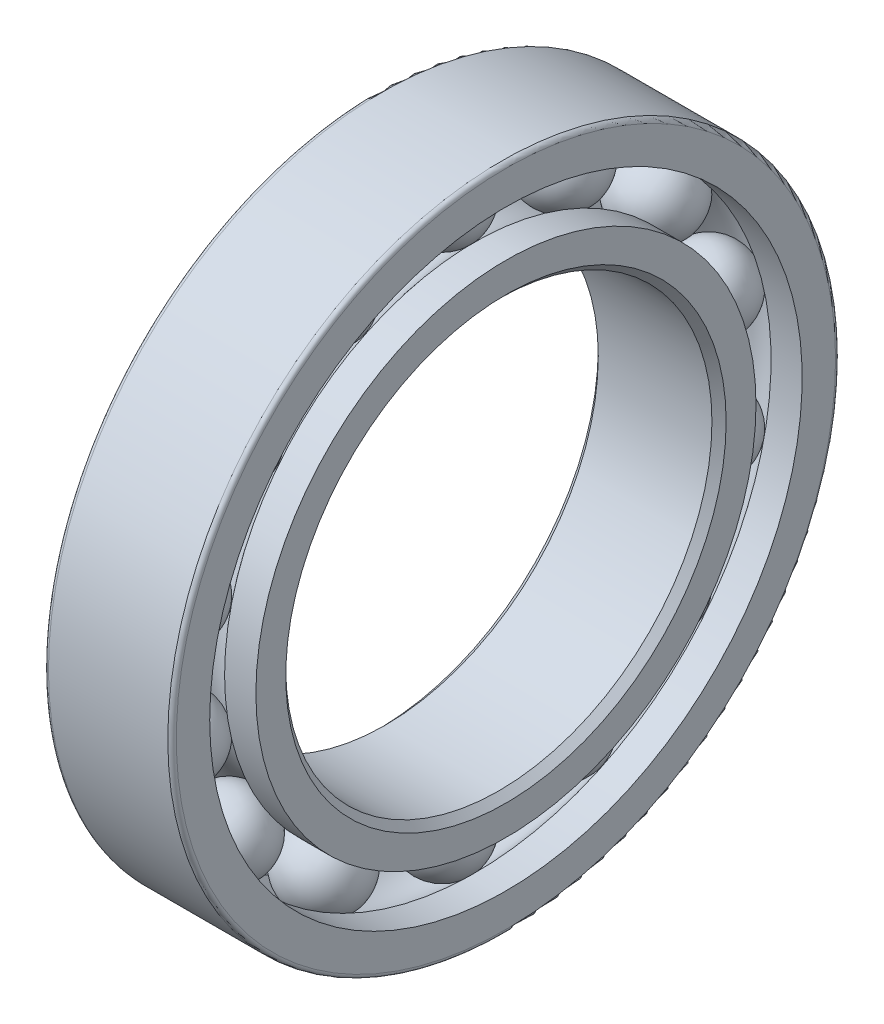
from build123d import *

# Parameters (mm, degrees)
CIRPATTERN1_COUNT = 14
FILLET1_R         = 0.3
CHAMFER1_SIZE     = 0.5


with BuildPart() as part:
    # Sketch1 → Revolve1 (revolve)
    with BuildSketch(Plane.XY):
        with BuildLine():
            Line((4.5, 20.85), (4.5, 23.5))
            Line((4.5, 23.5), (-4.5, 23.5))
            Line((-4.5, 23.5), (-4.5, 20.85))
            Line((-4.5, 20.85), (-2.311950123, 20.85))
            ThreePointArc((-2.311950123, 20.85), (0, 22.055297441), (2.311950123, 20.85))
            Line((2.311950123, 20.85), (4.5, 20.85))
        make_face()
        with BuildLine():
            ThreePointArc((2.297415927, 17.6), (0, 16.415315922), (-2.297415927, 17.6))
            Line((-2.297415927, 17.6), (-4.5, 17.6))
            Line((-4.5, 17.6), (-4.5, 15))
            Line((-4.5, 15), (4.5, 15))
            Line((4.5, 15), (4.5, 17.6))
            Line((4.5, 17.6), (2.297415927, 17.6))
        make_face()
    revolve(axis=Axis((-39.034090909, 0, 0), (1, 0, 0)))

    # Fillet1
    fillet1_edges = [part.edges().sort_by_distance(p)[0] for p in [
        (4.5, -23.5, 0),
        (-4.5, -23.5, 0),
    ]]
    fillet(fillet1_edges, radius=FILLET1_R)

    # Chamfer1
    chamfer1_edges = [part.edges().sort_by_distance(p)[0] for p in [
        (4.5, -15, 0),
        (-4.5, -15, 0),
    ]]
    chamfer(chamfer1_edges, length=CHAMFER1_SIZE)


with BuildPart() as body_2:
    # Sketch2 → Revolve2 (revolve)
    with BuildSketch(Plane.XY):
        with BuildLine():
            ThreePointArc((2.8, 19.24), (0, 22.04), (-2.8, 19.24))
            Line((-2.8, 19.24), (2.8, 19.24))
        make_face()
    revolve(axis=Axis((-2.8, 19.24, 0), (1, 0, 0)))


with BuildPart() as cirpattern1_1:
    # CirPattern1: pattern copy
    add(body_2.part.rotate(Axis((4.5, 0, 0), (-1, 0, 0)), 1 * 360 / CIRPATTERN1_COUNT))


with BuildPart() as cirpattern1_2:
    # CirPattern1: pattern copy
    add(body_2.part.rotate(Axis((4.5, 0, 0), (-1, 0, 0)), 2 * 360 / CIRPATTERN1_COUNT))


with BuildPart() as cirpattern1_3:
    # CirPattern1: pattern copy
    add(body_2.part.rotate(Axis((4.5, 0, 0), (-1, 0, 0)), 3 * 360 / CIRPATTERN1_COUNT))


with BuildPart() as cirpattern1_4:
    # CirPattern1: pattern copy
    add(body_2.part.rotate(Axis((4.5, 0, 0), (-1, 0, 0)), 4 * 360 / CIRPATTERN1_COUNT))


with BuildPart() as cirpattern1_5:
    # CirPattern1: pattern copy
    add(body_2.part.rotate(Axis((4.5, 0, 0), (-1, 0, 0)), 5 * 360 / CIRPATTERN1_COUNT))


with BuildPart() as cirpattern1_6:
    # CirPattern1: pattern copy
    add(body_2.part.rotate(Axis((4.5, 0, 0), (-1, 0, 0)), 6 * 360 / CIRPATTERN1_COUNT))


with BuildPart() as cirpattern1_7:
    # CirPattern1: pattern copy
    add(body_2.part.rotate(Axis((4.5, 0, 0), (-1, 0, 0)), 7 * 360 / CIRPATTERN1_COUNT))


with BuildPart() as cirpattern1_8:
    # CirPattern1: pattern copy
    add(body_2.part.rotate(Axis((4.5, 0, 0), (-1, 0, 0)), 8 * 360 / CIRPATTERN1_COUNT))


with BuildPart() as cirpattern1_9:
    # CirPattern1: pattern copy
    add(body_2.part.rotate(Axis((4.5, 0, 0), (-1, 0, 0)), 9 * 360 / CIRPATTERN1_COUNT))


with BuildPart() as cirpattern1_10:
    # CirPattern1: pattern copy
    add(body_2.part.rotate(Axis((4.5, 0, 0), (-1, 0, 0)), 10 * 360 / CIRPATTERN1_COUNT))


with BuildPart() as cirpattern1_11:
    # CirPattern1: pattern copy
    add(body_2.part.rotate(Axis((4.5, 0, 0), (-1, 0, 0)), 11 * 360 / CIRPATTERN1_COUNT))


with BuildPart() as cirpattern1_12:
    # CirPattern1: pattern copy
    add(body_2.part.rotate(Axis((4.5, 0, 0), (-1, 0, 0)), 12 * 360 / CIRPATTERN1_COUNT))


with BuildPart() as cirpattern1_13:
    # CirPattern1: pattern copy
    add(body_2.part.rotate(Axis((4.5, 0, 0), (-1, 0, 0)), 13 * 360 / CIRPATTERN1_COUNT))


solid = Compound([part.part, body_2.part, cirpattern1_1.part, cirpattern1_2.part, cirpattern1_3.part, cirpattern1_4.part, cirpattern1_5.part, cirpattern1_6.part, cirpattern1_7.part, cirpattern1_8.part, cirpattern1_9.part, cirpattern1_10.part, cirpattern1_11.part, cirpattern1_12.part, cirpattern1_13.part])
